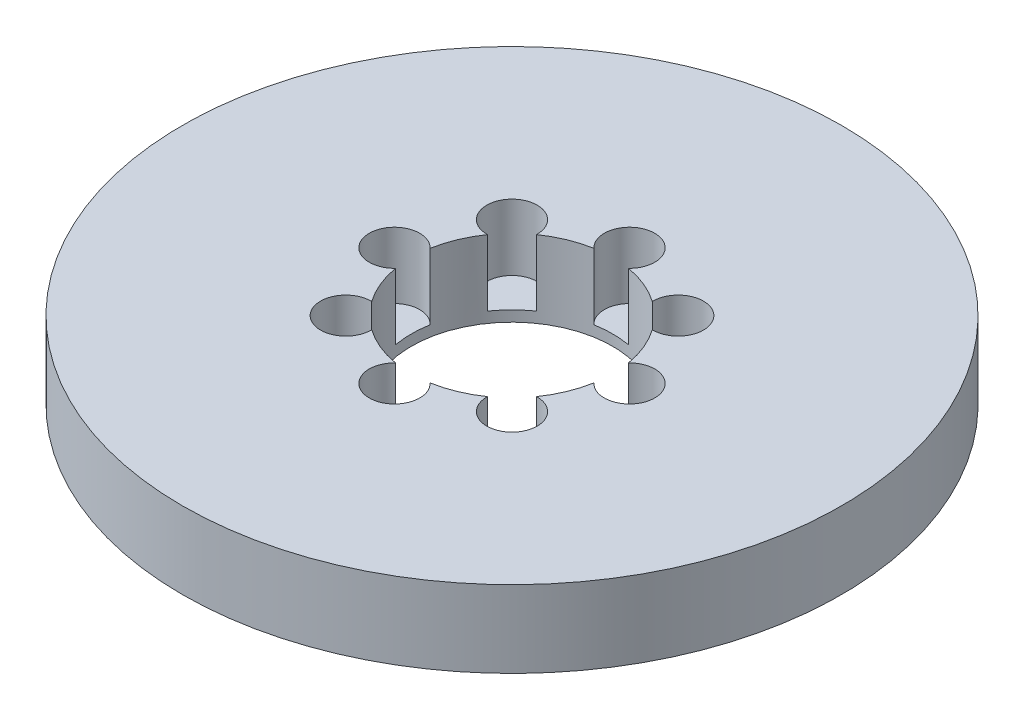
from build123d import *

# Parameters (mm, degrees)
SKETCH1_R           = 90
BOSS_EXTRUDE1_DEPTH = 21
SKETCH2_R           = 27.5
CUT_EXTRUDE1_DEPTH  = 130
SKETCH3_R           = 6.882579281
CUT_EXTRUDE2_DEPTH  = 18.069161235
CIRPATTERN1_COUNT   = 8


with BuildPart() as part:
    # Sketch1 → Boss-Extrude1 (new body)
    with BuildSketch(Plane(origin=(0, 0, 0), x_dir=(1, 0, 0), z_dir=(0, 1, 0))):
        Circle(SKETCH1_R)
    extrude(amount=BOSS_EXTRUDE1_DEPTH)

    # Sketch2 → Cut-Extrude1 (cut, through all)
    with BuildSketch(Plane(origin=(0, 0, 0), x_dir=(1, 0, 0), z_dir=(0, 1, 0))):
        Circle(SKETCH2_R)
    extrude(amount=CUT_EXTRUDE1_DEPTH, mode=Mode.SUBTRACT)

    # Sketch3 → Cut-Extrude2 (cut)
    with BuildSketch(Plane(origin=(0, 21, 0), x_dir=(1, 0, 0), z_dir=(0, 1, 0))):
        with Locations((-32.094626943, 0)):
            Circle(SKETCH3_R)
    cut_extrude2 = extrude(amount=-CUT_EXTRUDE2_DEPTH, mode=Mode.SUBTRACT)

    # CirPattern1: Cut-Extrude2 ×8 about axis
    cirpattern1_axis = Axis((0, 0, 0), (0, 1, 0))
    for i in range(1, CIRPATTERN1_COUNT):
        add(cut_extrude2.rotate(cirpattern1_axis, i * 360 / CIRPATTERN1_COUNT), mode=Mode.SUBTRACT)


solid = part.part
